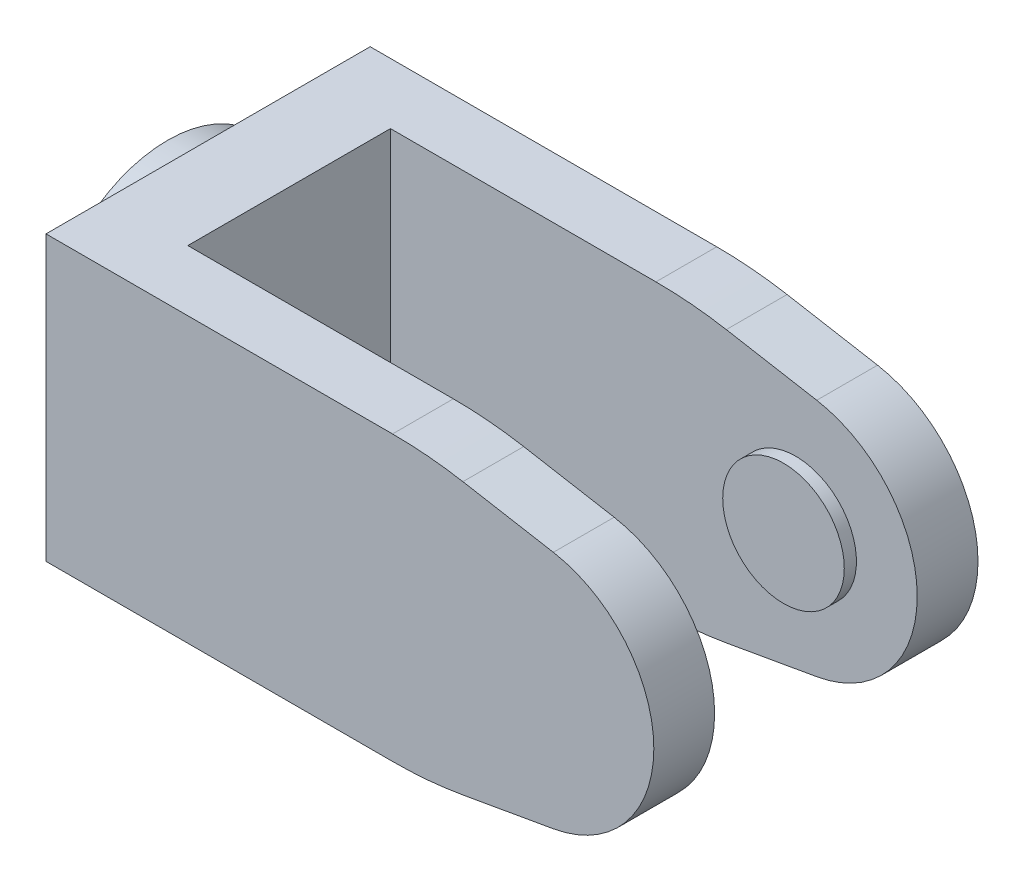
from build123d import *

# Parameters (mm, degrees)
BOSS_EXTRUDE1_DEPTH = 40
SKETCH2_W           = 154.782746008
SKETCH2_H           = 50
CUT_EXTRUDE1_DEPTH  = 113.744158528
SKETCH2_2_W         = 154.782746008
SKETCH2_2_H         = 50
CUT_EXTRUDE2_DEPTH  = 113.744158528
SKETCH3_R           = 15
BOSS_EXTRUDE2_DEPTH = 3
SKETCH4_R           = 30
BOSS_EXTRUDE3_DEPTH = 10
SKETCH5_R           = 25
BOSS_EXTRUDE4_DEPTH = 3
FILLET1_R           = 100
FILLET2_R           = 100


with BuildPart() as part:
    # Sketch1 → Boss-Extrude1 (new, symmetric)
    with BuildSketch(Plane.XY):
        with BuildLine():
            Line((-54.159677949, -43.884825983), (40.108572858, -43.884825983))
            Line((40.108572858, -43.884825983), (71.049767381, -38.429058573))
            ThreePointArc((71.049767381, -38.429058573), (95.840322051, -8.884825983), (71.049767381, 20.659406608))
            Line((71.049767381, 20.659406608), (40.108572858, 26.115174017))
            Line((40.108572858, 26.115174017), (-54.159677949, 26.115174017))
            Line((-54.159677949, 26.115174017), (-54.159677949, -43.884825983))
        make_face()
    extrude(amount=BOSS_EXTRUDE1_DEPTH, both=True)

    # Sketch2 → Cut-Extrude1 (cut, through all)
    with BuildSketch(Plane(origin=(0, 0, 0), x_dir=(1, 0, 0), z_dir=(0, 1, 0))):
        with Locations((43.231695055, 0)):
            Rectangle(SKETCH2_W, SKETCH2_H)
    extrude(amount=-CUT_EXTRUDE1_DEPTH, mode=Mode.SUBTRACT)

    # Sketch2<2> → Cut-Extrude2 (cut, through all)
    with BuildSketch(Plane(origin=(0, 0, 0), x_dir=(1, 0, 0), z_dir=(0, 1, 0))):
        with Locations((43.231695055, 0)):
            Rectangle(SKETCH2_2_W, SKETCH2_2_H)
    extrude(amount=CUT_EXTRUDE2_DEPTH, mode=Mode.SUBTRACT)

    # Sketch3 → Boss-Extrude2 (add)
    with BuildSketch(Plane.XY.offset(-25)):
        with Locations((65.840322051, -8.884825983)):
            Circle(SKETCH3_R)
    boss_extrude2 = extrude(amount=BOSS_EXTRUDE2_DEPTH)

    # Mirror1: Boss-Extrude2 across plane
    add(boss_extrude2.mirror(Plane.XY))

    # Sketch4 → Boss-Extrude3 (add)
    with BuildSketch(Plane.ZY.offset(54.159677949)):
        with Locations((0, -8.884825983)):
            Circle(SKETCH4_R)
    extrude(amount=BOSS_EXTRUDE3_DEPTH)

    # Sketch5 → Boss-Extrude4 (add)
    with BuildSketch(Plane.ZY.offset(64.159677949)):
        with Locations((0, -8.884825983)):
            Circle(SKETCH5_R)
    extrude(amount=BOSS_EXTRUDE4_DEPTH)

    # Fillet1
    fillet1_edges = [part.edges().sort_by_distance(p)[0] for p in [
        (40.108572858, 26.115174017, 32.5),
        (40.108572858, 26.115174017, -32.5),
    ]]
    fillet(fillet1_edges, radius=FILLET1_R)

    # Fillet2
    fillet2_edges = [part.edges().sort_by_distance(p)[0] for p in [
        (40.108572858, -43.884825983, -32.5),
        (40.108572858, -43.884825983, 32.5),
    ]]
    fillet(fillet2_edges, radius=FILLET2_R)


solid = part.part
